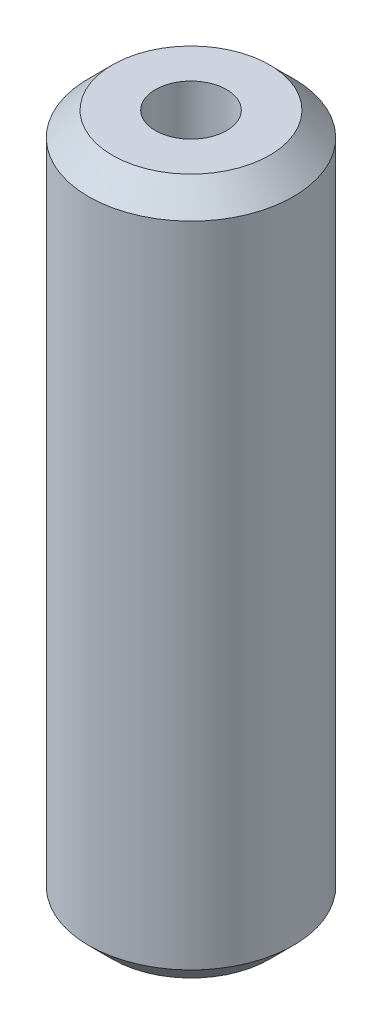
from build123d import *

# Parameters (mm, degrees)
SKETCH1_R           = 20
BOSS_EXTRUDE1_DEPTH = 136.049361739
SKETCH2_R           = 6.958201414
CUT_EXTRUDE1_DEPTH  = 139.958370851
CHAMFER1_SIZE       = 4.661647989


with BuildPart() as part:
    # Sketch1 → Boss-Extrude1 (new body)
    with BuildSketch(Plane(origin=(0, 0, 0), x_dir=(1, 0, 0), z_dir=(0, 1, 0))):
        Circle(SKETCH1_R)
    extrude(amount=BOSS_EXTRUDE1_DEPTH)

    # Sketch2 → Cut-Extrude1 (cut, through all)
    with BuildSketch(Plane(origin=(0, 0, 0), x_dir=(1, 0, 0), z_dir=(0, 1, 0))):
        Circle(SKETCH2_R)
    extrude(amount=CUT_EXTRUDE1_DEPTH, mode=Mode.SUBTRACT)

    # Chamfer1
    chamfer1_edges = [part.edges().sort_by_distance(p)[0] for p in [
        (-20, 136.049361739, 0),
        (-20, 0, 0),
    ]]
    chamfer(chamfer1_edges, length=CHAMFER1_SIZE)


solid = part.part
